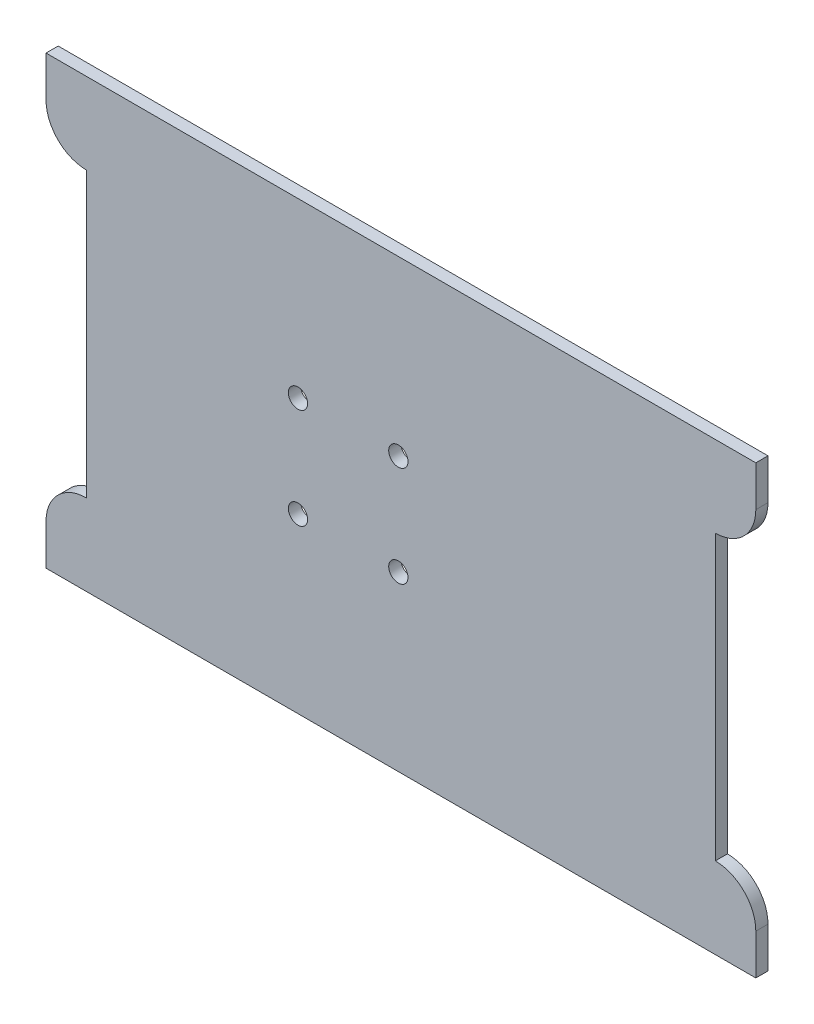
from build123d import *

# Parameters (mm, degrees)
SKETCH_2_W             = 70
SKETCH_2_H             = 44
SM_BASE_FLANGE_1_DEPTH = 1.2
CUT_EXTRUDE_1_DEPTH    = 42.357466073
SKETCH_6_R             = 0.95
CUT_EXTRUDE_2_DEPTH    = 42.357466073


# Sheet-metal steps are written as plain solids
with BuildPart() as part:
    # 草图2 → 基体-法兰1 (new body)
    with BuildSketch(Plane.XY):
        Rectangle(SKETCH_2_W, SKETCH_2_H)
    extrude(amount=-SM_BASE_FLANGE_1_DEPTH)

    # 草图5 → 切除-拉伸1 (cut, through all)
    with BuildSketch(Plane.XY):
        with BuildLine():
            Line((39, -14), (35, -14))
            Line((35, -14), (35, -18))
            ThreePointArc((35, -18), (33.828427125, -15.171572875), (31, -14))
            Line((31, -14), (31, 14))
            ThreePointArc((31, 14), (33.828427125, 15.171572875), (35, 18))
            Line((35, 18), (35, 14))
            Line((35, 14), (39, 14))
            Line((39, 14), (39, -14))
        make_face()
        with BuildLine():
            Line((-39, -14), (-39, 14))
            Line((-39, 14), (-35, 14))
            Line((-35, 14), (-35, 18))
            ThreePointArc((-35, 18), (-33.828427125, 15.171572875), (-31, 14))
            Line((-31, 14), (-31, -14))
            ThreePointArc((-31, -14), (-33.828427125, -15.171572875), (-35, -18))
            Line((-35, -18), (-35, -14))
            Line((-35, -14), (-39, -14))
        make_face()
    extrude(amount=-CUT_EXTRUDE_1_DEPTH, mode=Mode.SUBTRACT)

    # 草图6 → 切除-拉伸2 (cut, through all)
    with BuildSketch(Plane.XY):
        with Locations((-10.153838394, 4.949747468)):
            Circle(SKETCH_6_R)
        with Locations((-0.254343457, 4.949747468)):
            Circle(SKETCH_6_R)
        with Locations((-0.254343457, -4.949747468)):
            Circle(SKETCH_6_R)
        with Locations((-10.153838394, -4.949747468)):
            Circle(SKETCH_6_R)
    extrude(amount=-CUT_EXTRUDE_2_DEPTH, mode=Mode.SUBTRACT)


solid = part.part
